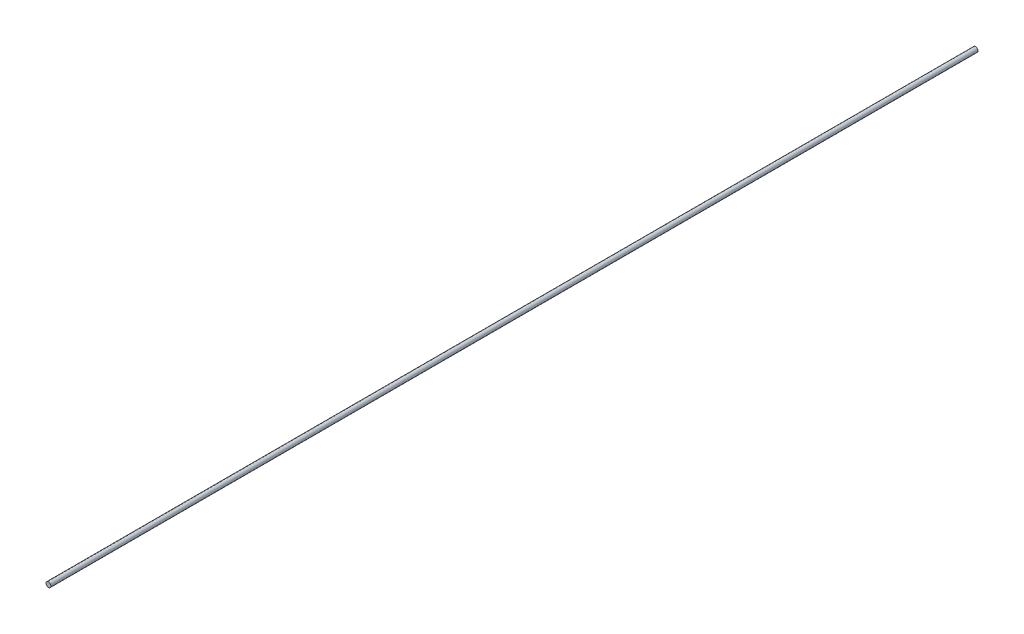
from build123d import *

# Parameters (mm, degrees)
SKETCH1_R           = 2
BOSS_EXTRUDE1_DEPTH = 761


with BuildPart() as part:
    # Sketch1 → Boss-Extrude1 (new body)
    with BuildSketch(Plane.XY):
        Circle(SKETCH1_R)
    extrude(amount=BOSS_EXTRUDE1_DEPTH)


solid = part.part
